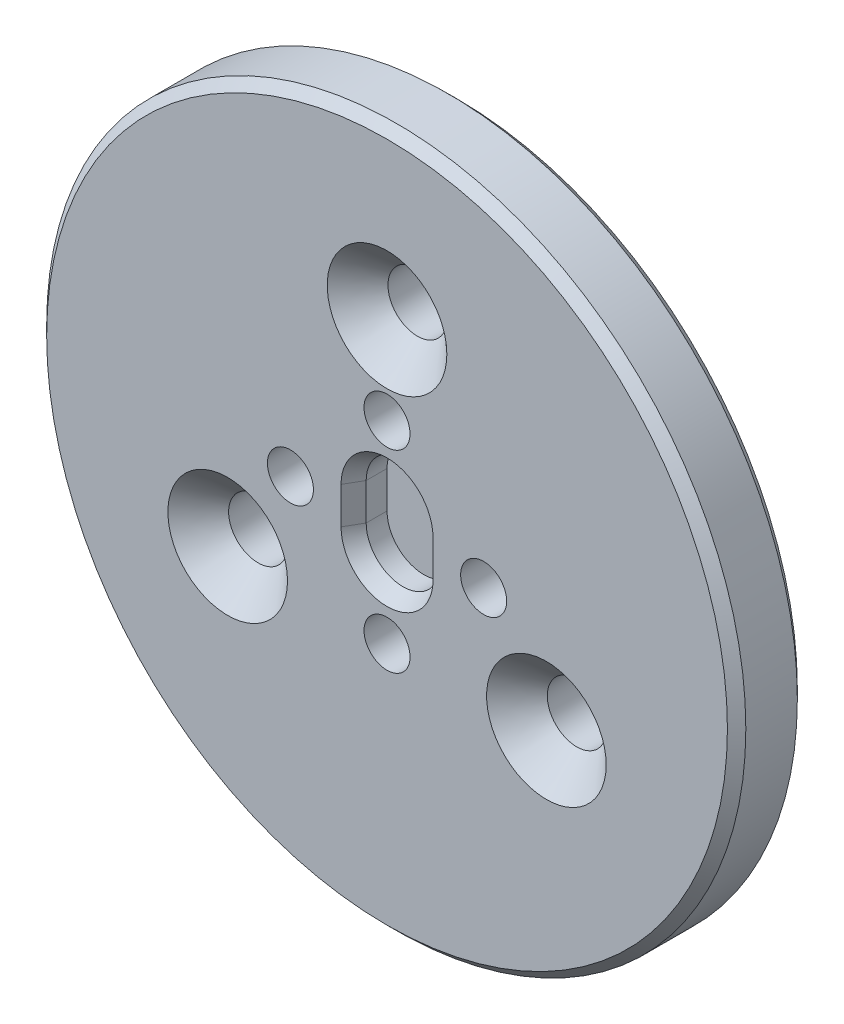
from build123d import *

# Parameters (mm, degrees)
SKETCH_1_R                   = 13.5
EXTRUDE_1_DEPTH              = 6
EXTRUDE_START                = -3.8
SKETCH_2_R                   = 19
SKETCH_2_R_2                 = 13.5
EXTRUDE_2_DEPTH              = 3.8
HOLE_WIZARD_M3_1_D           = 3.2
HOLE_WIZARD_M3_1_DEPTH       = 7
HOLE_WIZARD_M3_1_CSINK_D     = 6.5
HOLE_WIZARD_M3_1_CSINK_ANGLE = 90
HOLE_WIZARD_M3_1_TIP         = 0.96137699
F_2_0MM_1_D                  = 2
F_2_0MM_1_DEPTH              = 3.3
F_2_0MM_1_TIP                = 0.600860619
HOLE_WIZARD_M3_1_2_OUTLINE_R = 1.25
HOLE_WIZARD_M3_1_2_DEPTH     = 6
CUT_EXTRUDE_1_DEPTH          = 2
SKETCH_12_R                  = 17.5
SKETCH_12_R_2                = 14.5
CUT_EXTRUDE_3_DEPTH          = 2
EXTRUDE_START_2              = 2
EXTRUDE_3_DEPTH              = 2
CHAMFER_1_SIZE               = 0.5
FILLET_2_R                   = 1
CHAMFER_2_SIZE               = 0.5
CHAMFER_2_SIZE2              = 0.866025404
CHAMFER_3_SIZE               = 0.5


# Read off the part's stored shape, not the designer's step: M3 螺纹孔1
with BuildPart() as part:
    # 草图1 → 凸台-拉伸1 (new body)
    with BuildSketch(Plane.XY):
        Circle(SKETCH_1_R)
    extrude(amount=EXTRUDE_1_DEPTH)

    # 草图2 → 凸台-拉伸2 (add)
    with BuildSketch(Plane.XY.offset(6).offset(EXTRUDE_START)):
        Circle(SKETCH_2_R)
        Circle(SKETCH_2_R_2, mode=Mode.SUBTRACT)
    extrude(amount=EXTRUDE_2_DEPTH)

    # Hole Wizard M3 _1
    with Locations(Plane.XY.offset(6)):
        with Locations((8.660254038, -5), (0, 10), (-8.660254038, -5)):
            CounterSinkHole(HOLE_WIZARD_M3_1_D / 2, HOLE_WIZARD_M3_1_CSINK_D / 2, depth=HOLE_WIZARD_M3_1_DEPTH, counter_sink_angle=HOLE_WIZARD_M3_1_CSINK_ANGLE)
            with Locations((0, 0, -(HOLE_WIZARD_M3_1_DEPTH + HOLE_WIZARD_M3_1_TIP / 2))):  # 118° drill point
                Cone(0, HOLE_WIZARD_M3_1_D / 2, HOLE_WIZARD_M3_1_TIP, mode=Mode.SUBTRACT)

    # Ø2.0mm 暗销孔1
    with Locations(Plane(origin=(0, 0, 0), x_dir=(-1, 0, 0), z_dir=(0, 0, -1))):
        with Locations((8.660254038, 5), (0, -10), (-8.660254038, 5)):
            Hole(F_2_0MM_1_D / 2, depth=F_2_0MM_1_DEPTH)
            with Locations((0, 0, -(F_2_0MM_1_DEPTH + F_2_0MM_1_TIP / 2))):  # 118° drill point
                Cone(0, F_2_0MM_1_D / 2, F_2_0MM_1_TIP, mode=Mode.SUBTRACT)

    # Hole Wizard M3 _1 2 outline → Hole Wizard M3 _1 2 (cut)
    with BuildSketch(Plane.XY):
        with Locations((5.25, 0)):
            Circle(HOLE_WIZARD_M3_1_2_OUTLINE_R)
        with Locations((0, -5.25)):
            Circle(HOLE_WIZARD_M3_1_2_OUTLINE_R)
        with Locations((-5.25, 0)):
            Circle(HOLE_WIZARD_M3_1_2_OUTLINE_R)
        with Locations((0, 5.25)):
            Circle(HOLE_WIZARD_M3_1_2_OUTLINE_R)
    extrude(amount=HOLE_WIZARD_M3_1_2_DEPTH, mode=Mode.SUBTRACT)

    # 草图10 → 切除-拉伸1 (cut)
    with BuildSketch(Plane.XY.offset(6)):
        with BuildLine():
            Line((-2, -1), (-2, 1))
            ThreePointArc((-2, 1), (0, 3), (2, 1))
            Line((2, 1), (2, -1))
            ThreePointArc((2, -1), (0, -3), (-2, -1))
        make_face()
    extrude(amount=-CUT_EXTRUDE_1_DEPTH, mode=Mode.SUBTRACT)

    # 草图12 → 切除-拉伸3 (cut)
    with BuildSketch(Plane(origin=(0, 0, 2.2), x_dir=(-1, 0, 0), z_dir=(0, 0, -1))):
        Circle(SKETCH_12_R)
        Circle(SKETCH_12_R_2, mode=Mode.SUBTRACT)
    extrude(amount=-CUT_EXTRUDE_3_DEPTH, mode=Mode.SUBTRACT)

    # 草图13 → 凸台-拉伸3 (add)
    with BuildSketch(Plane(origin=(0, 0, 4.2), x_dir=(-1, 0, 0), z_dir=(0, 0, -1)).offset(EXTRUDE_START_2)):
        with BuildLine():
            Line((-2.517898576, 14.279712419), (-3.038843109, 17.234135678))
            ThreePointArc((-3.038843109, 17.234135678), (0, 17.5), (3.038843109, 17.234135678))
            Line((3.038843109, 17.234135678), (2.517898576, 14.279712419))
            ThreePointArc((2.517898576, 14.279712419), (0, 14.5), (-2.517898576, 14.279712419))
        make_face()
    extrude(amount=-EXTRUDE_3_DEPTH)

    # 倒角1
    chamfer_1_edges = [part.edges().sort_by_distance(p)[0] for p in [
        (-9.660254038, 5, 0),
        (-1, -10, 0),
        (7.660254038, 5, 0),
    ]]
    chamfer(chamfer_1_edges, length=CHAMFER_1_SIZE)

    # 圆角2
    fillet_2_edges = [part.edges().sort_by_distance(p)[0] for p in [
        (3.038843109, 17.234135678, 3.2),
        (-3.038843109, 17.234135678, 3.2),
        (-2.517898576, 14.279712419, 3.2),
        (2.517898576, 14.279712419, 3.2),
    ]]
    fillet(fillet_2_edges, radius=FILLET_2_R)

    # 倒角2
    chamfer_2_edges = [part.edges().sort_by_distance(p)[0] for p in [
        (0, -3, 6),
        (2, 0, 6),
        (0, 3, 6),
        (-2, 0, 6),
    ]]
    chamfer_2_side = [part.faces().sort_by_distance(p)[0] for p in [
        (-18.462598846, 0, 6),
    ]]
    chamfer(chamfer_2_edges, length=CHAMFER_2_SIZE, length2=CHAMFER_2_SIZE2, reference=chamfer_2_side[0])

    # 倒角3
    chamfer_3_edges = [part.edges().sort_by_distance(p)[0] for p in [
        (-2.772933692, 15.726088432, 2.2),
        (0, -14.5, 2.2),
        (0, -17.5, 2.2),
        (2.772933692, 15.726088432, 2.2),
        (-2.833509711, 14.512231288, 2.2),
        (-3.296257199, 16.88197424, 2.2),
        (3.296257199, 16.88197424, 2.2),
        (2.833509711, 14.512231288, 2.2),
        (-13.5, 0, 0),
        (-19, 0, 2.2),
        (-19, 0, 6),
    ]]
    chamfer(chamfer_3_edges, length=CHAMFER_3_SIZE)


solid = part.part
